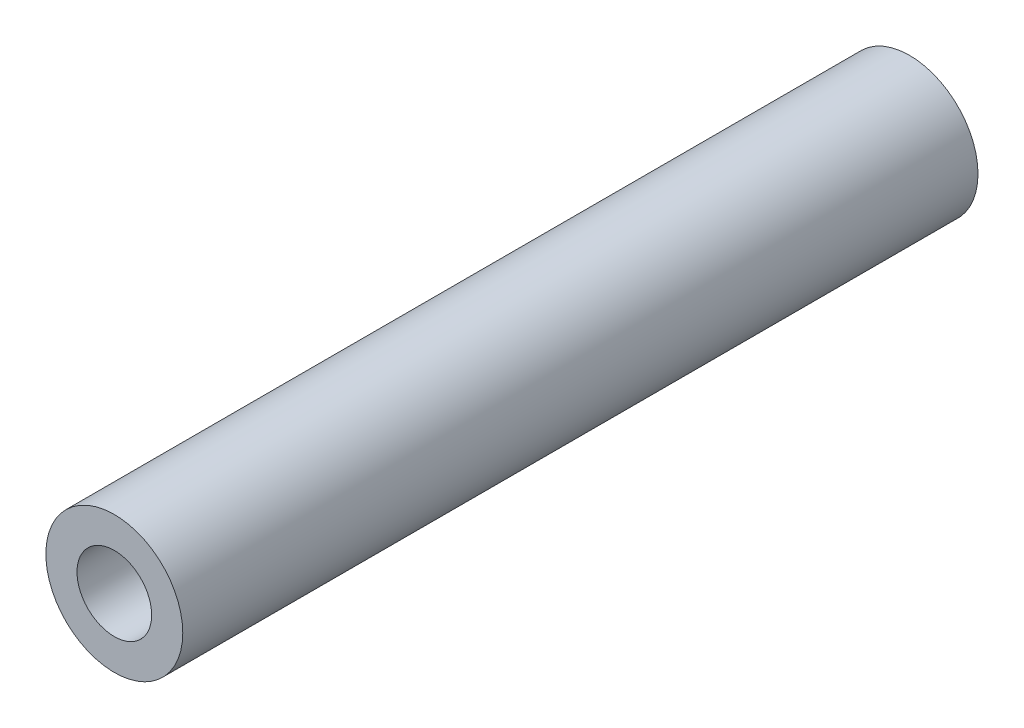
from build123d import *

# Parameters (mm, degrees)
SKETCH1_R           = 2.75
SKETCH1_R_2         = 1.5
BOSS_EXTRUDE1_DEPTH = 31.95


with BuildPart() as part:
    # Sketch1 → Boss-Extrude1 (new body)
    with BuildSketch(Plane.XY):
        Circle(SKETCH1_R)
        Circle(SKETCH1_R_2, mode=Mode.SUBTRACT)
    extrude(amount=BOSS_EXTRUDE1_DEPTH)


solid = part.part
